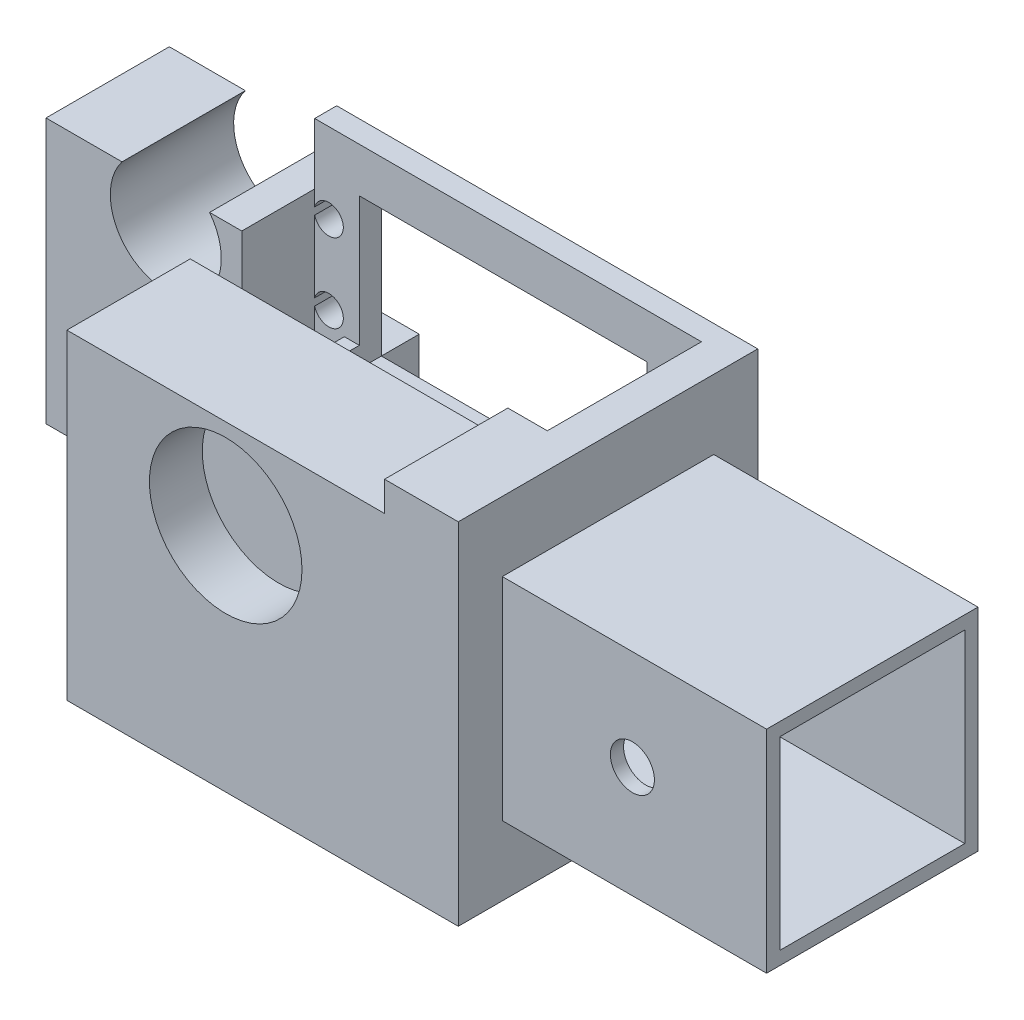
from build123d import *

# Parameters (mm, degrees)
SKETCH1_W                = 54.356
SKETCH1_H                = 34.4678
SKETCH1_W_2              = 40.2082
SKETCH1_H_2              = 20.32
BOSS_EXTRUDE1_DEPTH      = 27.94
SKETCH2_W                = 54.356
SKETCH2_H                = 34.4678
SKETCH2_W_2              = 45.7962
SKETCH2_H_2              = 25.908
CUT_EXTRUDE1_DEPTH       = 24.765
SKETCH3_R                = 2.04968225
SKETCH3_R_2              = 2.0955
CUT_EXTRUDE2_DEPTH       = 43.618007851
SKETCH4_W                = 19.05
SKETCH4_H                = 9.525
CUT_EXTRUDE3_DEPTH       = 12.7
SKETCH5_W                = 45.7962
SKETCH5_H                = 25.908
BOSS_EXTRUDE2_DEPTH      = 2.54
SKETCH6_W                = 25.4
SKETCH6_H                = 4.2799
BOSS_EXTRUDE3_DEPTH      = 27.305
SKETCH7_W                = 25.4
SKETCH7_H                = 6.35
BOSS_EXTRUDE4_DEPTH      = 19.05
SKETCH10_W               = 3.175
SKETCH10_H               = 19.05
BOSS_EXTRUDE5_DEPTH      = 19.05
CHAMFER1_SIZE            = 19.05
SKETCH12_W               = 7.62
SKETCH12_H               = 31.75
BOSS_EXTRUDE6_DEPTH      = 3.175
SKETCH13_W               = 41.4782
SKETCH13_H               = 21.59
CUT_EXTRUDE7_DEPTH       = 27.94
SKETCH14_W               = 22.225
SKETCH14_H               = 20.828
SKETCH14_W_2             = 49.53
SKETCH14_H_2             = 7.4549
CUT_EXTRUDE8_DEPTH       = 61.866925258
SKETCH15_W               = 3.175
SKETCH15_H               = 4.2799
CUT_EXTRUDE9_DEPTH       = 64.49980823
SKETCH16_W               = 45.796723327
SKETCH16_H               = 30.48
BOSS_EXTRUDE7_DEPTH      = 20.32
BOSS_EXTRUDE8_DEPTH      = 7.62
BOSS_EXTRUDE8_DEPTH_BACK = 10.16
SKETCH17_W               = 36.0299
SKETCH17_H               = 20.32
SKETCH18_W               = 28.227007584
SKETCH18_H               = 17.78
BOSS_EXTRUDE9_DEPTH      = 17.871186
SKETCH19_R               = 8.001
CUT_EXTRUDE10_DEPTH      = 17.78
SKETCH20_W               = 19.05
SKETCH20_H               = 21.1201
CUT_EXTRUDE11_DEPTH      = 70.85190382
SKETCH21_W               = 45.796723327
SKETCH21_H               = 46.228
BOSS_EXTRUDE10_DEPTH     = 12.7
SKETCH23_R               = 10.9982
CUT_EXTRUDE12_DEPTH      = 7.62
SKETCH25_W               = 6.35
SKETCH25_H               = 7.62
SKETCH25_W_2             = 10.629376673
SKETCH25_H_2             = 25.1079
BOSS_EXTRUDE12_DEPTH     = 3.175
SKETCH26_W               = 10.629376673
SKETCH26_H               = 50.5079
BOSS_EXTRUDE14_DEPTH     = 17.78
BOSS_EXTRUDE15_START     = -3.175
SKETCH27_W               = 4.942428742
SKETCH27_H               = 50.5079
BOSS_EXTRUDE15_DEPTH     = 25.4
SKETCH28_W               = 7.846471258
SKETCH28_H               = 22.225
BOSS_EXTRUDE16_DEPTH     = 25.4
SKETCH29_W               = 30.48
SKETCH29_H               = 30.48
BOSS_EXTRUDE17_DEPTH     = 38.1
SKETCH30_W               = 26.67
SKETCH30_H               = 26.67
CUT_EXTRUDE13_DEPTH      = 38.1
SKETCH31_R               = 3.175
CUT_EXTRUDE14_DEPTH      = 88.144583079


with BuildPart() as part:
    # Sketch1 → Boss-Extrude1 (new body)
    with BuildSketch(Plane.XY):
        Rectangle(SKETCH1_W, SKETCH1_H)
        Rectangle(SKETCH1_W_2, SKETCH1_H_2, mode=Mode.SUBTRACT)
    extrude(amount=-BOSS_EXTRUDE1_DEPTH)

    # Sketch2 → Cut-Extrude1 (cut)
    with BuildSketch(Plane.XY):
        Rectangle(SKETCH2_W, SKETCH2_H)
        Rectangle(SKETCH2_W_2, SKETCH2_H_2, mode=Mode.SUBTRACT)
    extrude(amount=-CUT_EXTRUDE1_DEPTH, mode=Mode.SUBTRACT)

    # Sketch3 → Cut-Extrude2 (cut, through all)
    with BuildSketch(Plane(origin=(0, 0, -27.94), x_dir=(-1, 0, 0), z_dir=(0, 0, -1))):
        with Locations((-25.146, 5.6769)):
            Circle(SKETCH3_R)
        with Locations((-25.146, -5.6769)):
            Circle(SKETCH3_R_2)
        with Locations((25.146, -5.6769)):
            Circle(SKETCH3_R_2)
        with Locations((25.146, 5.6769)):
            Circle(SKETCH3_R_2)
    extrude(amount=-CUT_EXTRUDE2_DEPTH, mode=Mode.SUBTRACT)

    # Sketch4 → Cut-Extrude3 (cut)
    with BuildSketch(Plane(origin=(22.8981, 0, 0), x_dir=(0, 0, -1), z_dir=(1, 0, 0))):
        with Locations((12.065, 0)):
            Rectangle(SKETCH4_W, SKETCH4_H)
    extrude(amount=-CUT_EXTRUDE3_DEPTH, mode=Mode.SUBTRACT)

    # Sketch5 → Boss-Extrude2 (add)
    with BuildSketch(Plane.XY):
        Rectangle(SKETCH5_W, SKETCH5_H)
    extrude(amount=BOSS_EXTRUDE2_DEPTH)

    # Sketch6 → Boss-Extrude3 (add)
    with BuildSketch(Plane.XY.offset(2.54)):
        with Locations((0, -15.09395)):
            Rectangle(SKETCH6_W, SKETCH6_H)
    extrude(amount=-BOSS_EXTRUDE3_DEPTH)

    # Sketch7 → Boss-Extrude4 (add)
    with BuildSketch(Plane.XY.offset(2.54)):
        with Locations((0, -14.0589)):
            Rectangle(SKETCH7_W, SKETCH7_H)
    extrude(amount=BOSS_EXTRUDE4_DEPTH)

    # Sketch10 → Boss-Extrude5 (add)
    with BuildSketch(Plane(origin=(0, -10.8839, 0), x_dir=(1, 0, 0), z_dir=(0, 1, 0))):
        with Locations((11.1125, -12.065)):
            Rectangle(SKETCH10_W, SKETCH10_H)
        with Locations((-11.1125, -12.065)):
            Rectangle(SKETCH10_W, SKETCH10_H)
    extrude(amount=BOSS_EXTRUDE5_DEPTH)

    # Chamfer1
    chamfer1_edges = [part.edges().sort_by_distance(p)[0] for p in [
        (-11.1125, 8.1661, 21.59),
        (11.1125, 8.1661, 21.59),
    ]]
    chamfer(chamfer1_edges, length=CHAMFER1_SIZE - 0.0001)  # a hair under: the kernel refuses the full size

    # Sketch12 → Boss-Extrude6 (add)
    with BuildSketch(Plane.XZ.offset(17.2339)):
        with Locations((0, -12.065)):
            Rectangle(SKETCH12_W, SKETCH12_H)
    extrude(amount=BOSS_EXTRUDE6_DEPTH)

    # Sketch13 → Cut-Extrude7 (cut)
    with BuildSketch(Plane(origin=(0, 0, -27.94), x_dir=(-1, 0, 0), z_dir=(0, 0, -1))):
        Rectangle(SKETCH13_W, SKETCH13_H)
    extrude(amount=-CUT_EXTRUDE7_DEPTH, mode=Mode.SUBTRACT)

    # Sketch14 → Cut-Extrude8 (cut, through all)
    with BuildSketch(Plane.ZY.offset(22.8981)):
        with Locations((-13.6525, 2.54)):
            Rectangle(SKETCH14_W, SKETCH14_H)
        with Locations((-3.175, -16.68145)):
            Rectangle(SKETCH14_W_2, SKETCH14_H_2)
    extrude(amount=-CUT_EXTRUDE8_DEPTH, mode=Mode.SUBTRACT)

    # Sketch15 → Cut-Extrude9 (cut, through all)
    with BuildSketch(Plane.ZY.offset(27.178)):
        with Locations((-26.3525, -15.09395)):
            Rectangle(SKETCH15_W, SKETCH15_H)
    extrude(amount=-CUT_EXTRUDE9_DEPTH, mode=Mode.SUBTRACT)

    # Sketch16 → Boss-Extrude7 (add)
    with BuildSketch(Plane.XZ.offset(12.954)):
        with Locations((0.000261663, -12.7)):
            Rectangle(SKETCH16_W, SKETCH16_H)
    extrude(amount=BOSS_EXTRUDE7_DEPTH)

    # Sketch20 → Cut-Extrude11 (cut, through all)
    with BuildSketch(Plane.ZY.offset(22.8981)):
        with Locations((12.065, -2.39395)):
            Rectangle(SKETCH20_W, SKETCH20_H)
    extrude(amount=-CUT_EXTRUDE11_DEPTH, mode=Mode.SUBTRACT)

    # Sketch21 → Boss-Extrude10 (add)
    with BuildSketch(Plane.XY.offset(2.54)):
        with Locations((0.000261663, -10.16)):
            Rectangle(SKETCH21_W, SKETCH21_H)
    extrude(amount=BOSS_EXTRUDE10_DEPTH)

    # Sketch23 → Cut-Extrude12 (cut)
    with BuildSketch(Plane.XY.offset(15.24)):
        with Locations((0.000261663, 0)):
            Circle(SKETCH23_R)
    extrude(amount=-CUT_EXTRUDE12_DEPTH, mode=Mode.SUBTRACT)

    # Sketch25 → Boss-Extrude12 (add)
    with BuildSketch(Plane(origin=(0, 0, -27.94), x_dir=(-1, 0, 0), z_dir=(0, 0, -1))):
        with Locations((-30.353, 13.4239)):
            Rectangle(SKETCH25_W, SKETCH25_H)
        with Locations((-28.213311664, -20.72005)):
            Rectangle(SKETCH25_W_2, SKETCH25_H_2)
    extrude(amount=-BOSS_EXTRUDE12_DEPTH)

    # Sketch26 → Boss-Extrude14 (add)
    with BuildSketch(Plane.XY.offset(15.24)):
        with Locations((28.213311664, -8.02005)):
            Rectangle(SKETCH26_W, SKETCH26_H)
    extrude(amount=-BOSS_EXTRUDE14_DEPTH)

    # Sketch27 → Boss-Extrude15 (add)
    with BuildSketch(Plane.XY.offset(-24.765).offset(BOSS_EXTRUDE15_START)):
        with Locations((31.056785629, -8.02005)):
            Rectangle(SKETCH27_W, SKETCH27_H)
    extrude(amount=BOSS_EXTRUDE15_DEPTH)

    # Sketch28 → Boss-Extrude16 (add)
    with BuildSketch(Plane(origin=(0, -7.874, 0), x_dir=(1, 0, 0), z_dir=(0, 1, 0))):
        with Locations((24.662335629, 13.6525)):
            Rectangle(SKETCH28_W, SKETCH28_H)
    extrude(amount=-BOSS_EXTRUDE16_DEPTH)

    # Sketch29 → Boss-Extrude17 (add)
    with BuildSketch(Plane(origin=(33.528, 0, 0), x_dir=(0, 0, -1), z_dir=(1, 0, 0))):
        with Locations((6.35, -8.02005)):
            Rectangle(SKETCH29_W, SKETCH29_H)
    extrude(amount=BOSS_EXTRUDE17_DEPTH)

    # Sketch30 → Cut-Extrude13 (cut)
    with BuildSketch(Plane(origin=(71.628, 0, 0), x_dir=(0, 0, -1), z_dir=(1, 0, 0))):
        with Locations((6.35, -8.02005)):
            Rectangle(SKETCH30_W, SKETCH30_H)
    extrude(amount=-CUT_EXTRUDE13_DEPTH, mode=Mode.SUBTRACT)

    # Sketch31 → Cut-Extrude14 (cut, through all)
    with BuildSketch(Plane(origin=(0, 0, -21.59), x_dir=(-1, 0, 0), z_dir=(0, 0, -1))):
        with Locations(Location((-52.281109358, -7.202098737, 0), (0, 0, 90))):
            Circle(SKETCH31_R)
    extrude(amount=-CUT_EXTRUDE14_DEPTH, mode=Mode.SUBTRACT)


with BuildPart() as body_2:
    # Sketch17 → Boss-Extrude8 (new, two sides: drawn at the far end of the back side and taken through both)
    with BuildSketch(Plane(origin=(0, 0, -27.94), x_dir=(-1, 0, 0), z_dir=(0, 0, -1)).offset(-BOSS_EXTRUDE8_DEPTH_BACK)):
        with Locations((40.91305, -23.114)):
            Rectangle(SKETCH17_W, SKETCH17_H)
    extrude(amount=BOSS_EXTRUDE8_DEPTH + BOSS_EXTRUDE8_DEPTH_BACK)

    # Sketch18 → Boss-Extrude9 (add)
    with BuildSketch(Plane(origin=(0, -12.954, 0), x_dir=(1, 0, 0), z_dir=(0, 1, 0))):
        with Locations((-44.814496208, 26.67)):
            Rectangle(SKETCH18_W, SKETCH18_H)
    extrude(amount=BOSS_EXTRUDE9_DEPTH)

    # Sketch19 → Cut-Extrude10 (cut)
    with BuildSketch(Plane(origin=(0, 0, -35.56), x_dir=(-1, 0, 0), z_dir=(0, 0, -1))):
        with Locations((41.656, 0)):
            Circle(SKETCH19_R)
    extrude(amount=-CUT_EXTRUDE10_DEPTH, mode=Mode.SUBTRACT)


solid = Compound([part.part, body_2.part])
